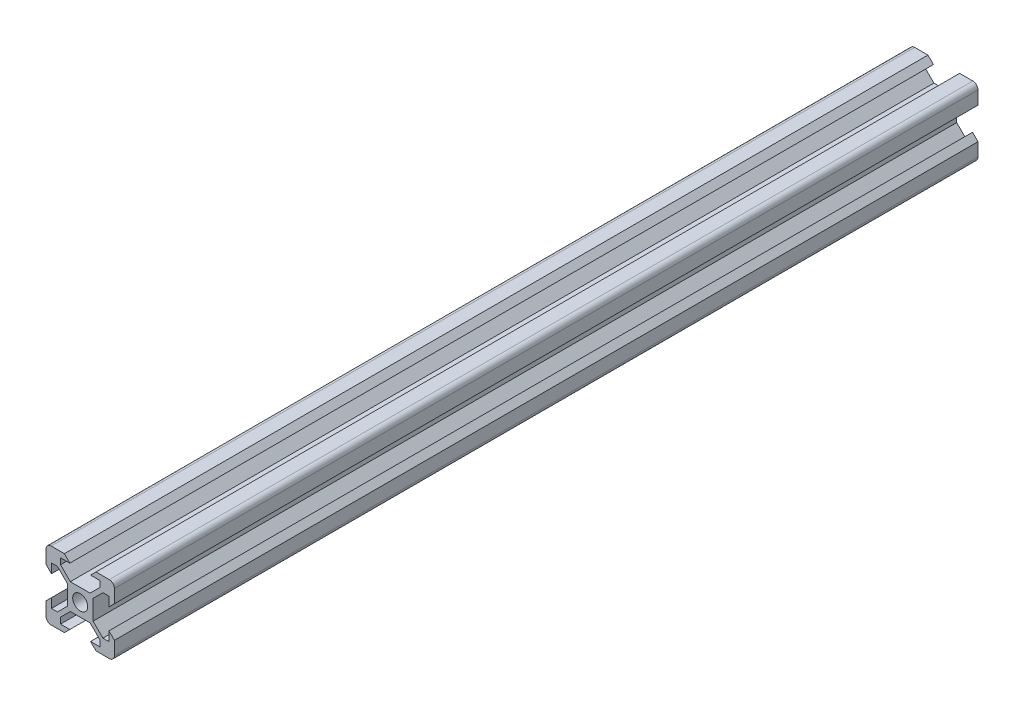
from build123d import *

# Parameters (mm, degrees)
SKETCH1_R           = 4.4
BOSS_EXTRUDE1_DEPTH = 252.5


with BuildPart() as part:
    # Sketch1 → Boss-Extrude1 (new, symmetric)
    with BuildSketch(Plane.XY):
        with BuildLine():
            Line((-13.271281672, 11.512), (-7.544, 5.784718328))
            Line((-7.544, 5.784718328), (-7.544, -5.784718328))
            Line((-7.544, -5.784718328), (-13.271281672, -11.512))
            Line((-13.271281672, -11.512), (-16.8, -11.512))
            Line((-16.8, -11.512), (-16.8, -6.051976926))
            Line((-16.8, -6.051976926), (-20, -9.251976926))
            Line((-20, -9.251976926), (-20, -17))
            ThreePointArc((-20, -17), (-19.121320344, -19.121320344), (-17, -20))
            Line((-17, -20), (-9.251976926, -20))
            Line((-9.251976926, -20), (-6.051976926, -16.8))
            Line((-6.051976926, -16.8), (-11.512, -16.8))
            Line((-11.512, -16.8), (-11.512, -13.271281672))
            Line((-11.512, -13.271281672), (-5.784718328, -7.544))
            Line((-5.784718328, -7.544), (5.784718328, -7.544))
            Line((5.784718328, -7.544), (11.512, -13.271281672))
            Line((11.512, -13.271281672), (11.512, -16.8))
            Line((11.512, -16.8), (6.051976926, -16.8))
            Line((6.051976926, -16.8), (9.251976926, -20))
            Line((9.251976926, -20), (17, -20))
            ThreePointArc((17, -20), (19.121320344, -19.121320344), (20, -17))
            Line((20, -17), (20, -9.251976926))
            Line((20, -9.251976926), (16.8, -6.051976926))
            Line((16.8, -6.051976926), (16.8, -11.512))
            Line((16.8, -11.512), (13.271281672, -11.512))
            Line((13.271281672, -11.512), (7.544, -5.784718328))
            Line((7.544, -5.784718328), (7.544, 5.784718328))
            Line((7.544, 5.784718328), (13.271281672, 11.512))
            Line((13.271281672, 11.512), (16.8, 11.512))
            Line((16.8, 11.512), (16.8, 6.051976926))
            Line((16.8, 6.051976926), (20, 9.251976926))
            Line((20, 9.251976926), (20, 17))
            ThreePointArc((20, 17), (19.121320344, 19.121320344), (17, 20))
            Line((17, 20), (9.251976926, 20))
            Line((9.251976926, 20), (6.051976926, 16.8))
            Line((6.051976926, 16.8), (11.512, 16.8))
            Line((11.512, 16.8), (11.512, 13.271281672))
            Line((11.512, 13.271281672), (5.784718328, 7.544))
            Line((5.784718328, 7.544), (-5.784718328, 7.544))
            Line((-5.784718328, 7.544), (-11.512, 13.271281672))
            Line((-11.512, 13.271281672), (-11.512, 16.8))
            Line((-11.512, 16.8), (-6.051976926, 16.8))
            Line((-6.051976926, 16.8), (-9.251976926, 20))
            Line((-9.251976926, 20), (-17, 20))
            ThreePointArc((-17, 20), (-19.121320344, 19.121320344), (-20, 17))
            Line((-20, 17), (-20, 9.251976926))
            Line((-20, 9.251976926), (-16.8, 6.051976926))
            Line((-16.8, 6.051976926), (-16.8, 11.512))
            Line((-16.8, 11.512), (-13.271281672, 11.512))
        make_face()
        Circle(SKETCH1_R, mode=Mode.SUBTRACT)
    extrude(amount=BOSS_EXTRUDE1_DEPTH, both=True)


solid = part.part
